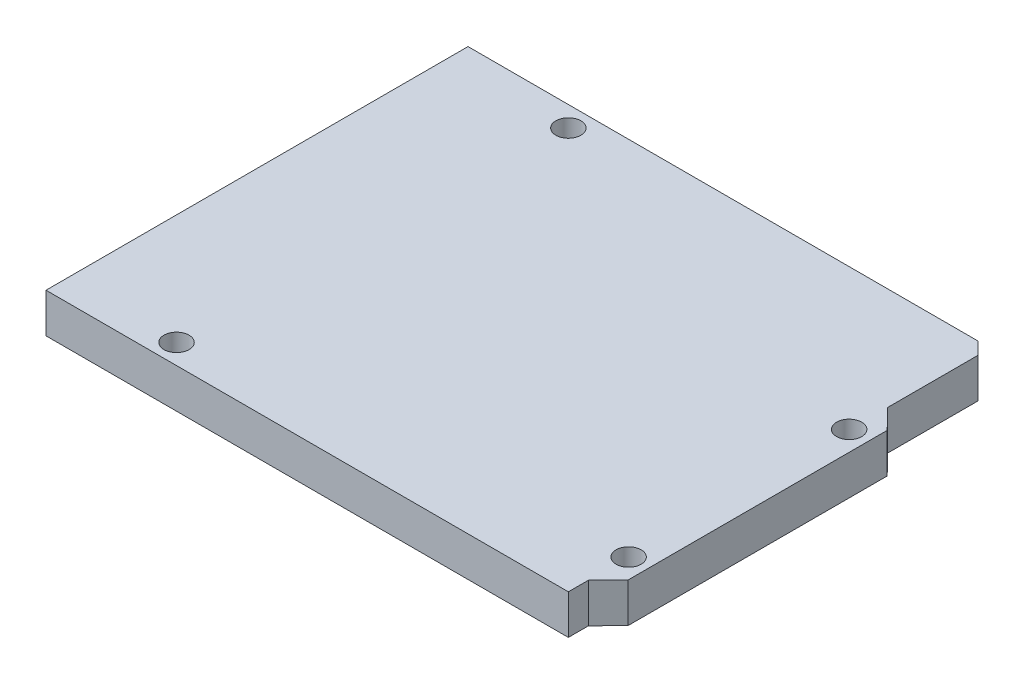
from build123d import *

# Parameters (mm, degrees)
SKETCH2_R           = 1.5875
BOSS_EXTRUDE1_DEPTH = 5


with BuildPart() as part:
    # Sketch2 → Boss-Extrude1 (new body)
    with BuildSketch(Plane(origin=(0, 0, 0), x_dir=(1, 0, 0), z_dir=(0, 1, 0))):
        Polygon((-53.480349242, 37.795561972), (11.024860758, 37.795561972), (12.589650758, 36.230771972), (12.589650758, 24.803091972), (15.069650758, 22.263091972), (15.069650758, -10.502908028), (12.589650758, -13.042908028), (12.589650758, -15.582908028), (-53.480349242, -15.582908028), align=None)
        with Locations((-38.210349242, 35.217091972)):
            Circle(SKETCH2_R, mode=Mode.SUBTRACT)
        with Locations((12.557854383, 19.965306842)):
            Circle(SKETCH2_R, mode=Mode.SUBTRACT)
        with Locations((12.589650758, -7.962908028)):
            Circle(SKETCH2_R, mode=Mode.SUBTRACT)
        with Locations((-39.510349242, -13.042908028)):
            Circle(SKETCH2_R, mode=Mode.SUBTRACT)
    extrude(amount=BOSS_EXTRUDE1_DEPTH)


solid = part.part
